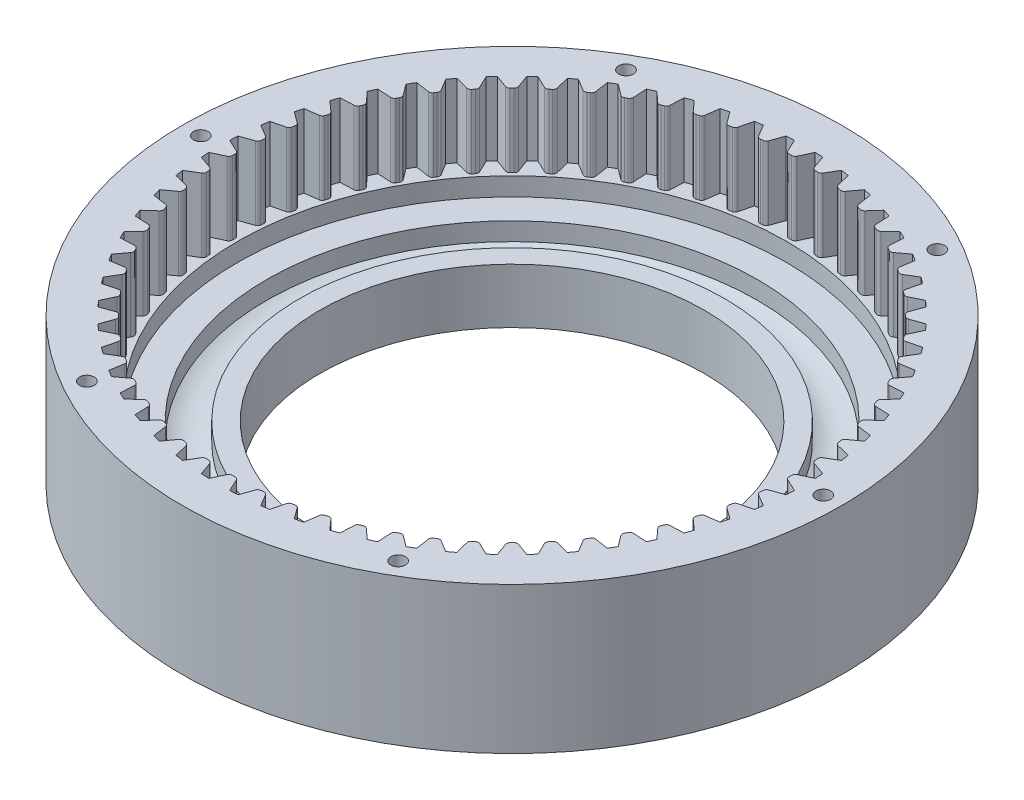
from build123d import *

# Parameters (mm, degrees)
BOSS_EXTRUDE1_DEPTH = 20
CIRPATTERN1_COUNT   = 64
SKETCH3_R           = 2
CUT_EXTRUDE1_DEPTH  = 15
CIRPATTERN2_COUNT   = 6
SKETCH4_R           = 4
CUT_EXTRUDE2_DEPTH  = 12
CIRPATTERN3_COUNT   = 4


with BuildPart() as part:
    # Sketch1 → Revolve1 (revolve)
    with BuildSketch(Plane.XY, mode=Mode.PRIVATE) as revolve1_sk:
        with BuildLine():
            Line((-90, 0), (-90, 40))
            Line((-90, 40), (-80, 40))
            Line((-80, 40), (-80, 20))
            Line((-80, 20), (-75, 20))
            Line((-75, 20), (-75, 15))
            Line((-75, 15), (-67, 15))
            Line((-67, 15), (-67, 10.06971445))
            ThreePointArc((-67, 10.06971445), (-62.5, 9), (-58, 10.06971445))
            Line((-58, 10.06971445), (-58, 15))
            Line((-58, 15), (-52.5, 15))
            Line((-52.5, 15), (-52.5, 0))
            Line((-52.5, 0), (-90, 0))
        make_face()
    revolve(revolve1_sk.sketch.rotate(Axis((0, 0, 0), (0, 1, 0)), 270), axis=Axis((0, 0, 0), (0, 1, 0)))

    # Sketch2 → Boss-Extrude1 (add)
    with BuildSketch(Plane(origin=(0, 20, 0), x_dir=(1, 0, 0), z_dir=(0, 1, 0))):
        with BuildLine():
            Line((-79.949514104, 2.841688673), (-76.577381738, 1.269237526))
            ThreePointArc((-76.577381738, 1.269237526), (-76.156608554, 0.900229348), (-76, 0.362929739))
            Line((-76, 0.362929739), (-76, -0.362929739))
            ThreePointArc((-76, -0.362929739), (-76.156608554, -0.900229348), (-76.577381738, -1.269237526))
            Line((-76.577381738, -1.269237526), (-79.949514104, -2.841688673))
            ThreePointArc((-79.949514104, -2.841688673), (-80, 0), (-79.949514104, 2.841688673))
        make_face()
    boss_extrude1 = extrude(amount=BOSS_EXTRUDE1_DEPTH)

    # CirPattern1: Boss-Extrude1 ×64 about axis
    cirpattern1_axis = Axis((0, 0, 0), (0, 1, 0))
    for i in range(1, CIRPATTERN1_COUNT):
        add(boss_extrude1.rotate(cirpattern1_axis, i * 360 / CIRPATTERN1_COUNT))

    # Sketch3 → Cut-Extrude1 (cut)
    with BuildSketch(Plane(origin=(0, 40, 0), x_dir=(1, 0, 0), z_dir=(0, 1, 0))):
        with Locations(Location((-85, 0, 0), (0, 0, 180))):
            Circle(SKETCH3_R)
    cut_extrude1 = extrude(amount=-CUT_EXTRUDE1_DEPTH, mode=Mode.SUBTRACT)

    # CirPattern2: Cut-Extrude1 ×6 about axis
    cirpattern2_axis = Axis((0, 0, 0), (0, 1, 0))
    for i in range(1, CIRPATTERN2_COUNT):
        add(cut_extrude1.rotate(cirpattern2_axis, i * 360 / CIRPATTERN2_COUNT), mode=Mode.SUBTRACT)

    # Sketch4 → Cut-Extrude2 (cut)
    with BuildSketch(Plane(origin=(0, 0, 0), x_dir=(-1, 0, 0), z_dir=(0, -1, 0))):
        with Locations(Location((78, 0, 0), (0, 0, 90))):
            Circle(SKETCH4_R)
    cut_extrude2 = extrude(amount=-CUT_EXTRUDE2_DEPTH, mode=Mode.SUBTRACT)

    # CirPattern3: Cut-Extrude2 ×4 about axis
    cirpattern3_axis = Axis((0, 0, 0), (0, 1, 0))
    for i in range(1, CIRPATTERN3_COUNT):
        add(cut_extrude2.rotate(cirpattern3_axis, i * 360 / CIRPATTERN3_COUNT), mode=Mode.SUBTRACT)


solid = part.part
